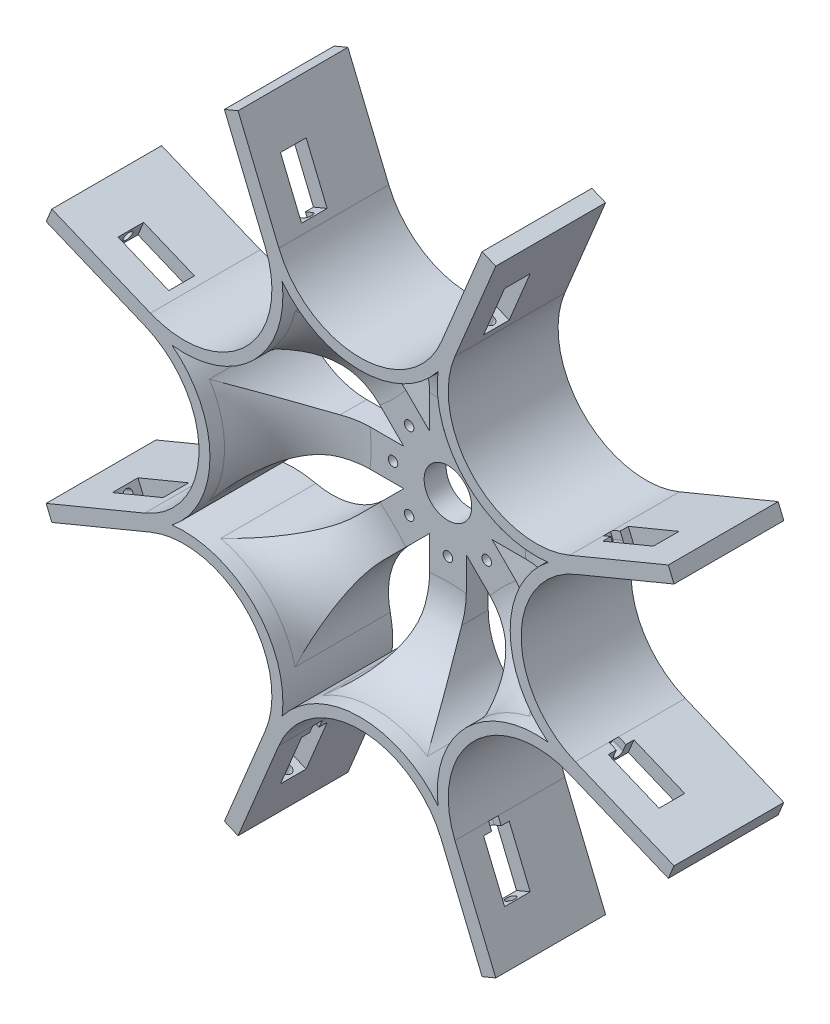
from build123d import *

# Parameters (mm, degrees)
MAIN_EXTRUSION_DEPTH         = 30
MAINREPETITION_DEPTH         = 30
ESQUISSE3_R                  = 1.3
CENTRAL_FIXING_DEPTH         = 6
FIXINGHOLEREPETITION_COUNT   = 8
CONG_4_R                     = 20
ESQUISSE4_R                  = 6.5
MAINHOLE_DEPTH               = 124.621368558
ESQUISSE5_W                  = 7
ESQUISSE5_H                  = 15
HOLEFORBEARING_DEPTH         = 5
ESQUISSE7_R                  = 1.3
ENL_V_MAT_EXTRU_3_DEPTH      = 3
ENL_V_MAT_EXTRU_2_DEPTH      = 3
R_P_TITION_CIRCULAIRE1_COUNT = 8


# Read off the part's stored shape, not the designer's step: MainRepetition
with BuildPart() as part:
    # Esquisse1 → Main Extrusion (new body)
    with BuildSketch(Plane.XY):
        with BuildLine():
            Line((57.667547326, 24.944747378), (84.602293038, 36.101484351))
            Line((84.602293038, 36.101484351), (85.750343335, 33.329845753))
            Line((85.750343335, 33.329845753), (58.815597623, 22.17310878))
            ThreePointArc((58.815597623, 22.17310878), (44, 0), (58.815597623, -22.17310878))
            Line((58.815597623, -22.17310878), (85.750343335, -33.329845753))
            Line((85.750343335, -33.329845753), (84.602293038, -36.101484351))
            Line((84.602293038, -36.101484351), (57.667547326, -24.944747378))
            ThreePointArc((57.667547326, -24.944747378), (41, 0), (57.667547326, 24.944747378))
        make_face()
    extrude(amount=MAIN_EXTRUSION_DEPTH)

    # MainRepetition outline → MainRepetition (add)
    with BuildSketch(Plane.XY):
        with BuildLine():
            Line((-84.202409209, -37.066889313), (-57.267663497, -25.91015234))
            ThreePointArc((-57.267663497, -25.91015234), (-31.112698372, -31.112698372), (-25.91015234, -57.267663497))
            Line((-25.91015234, -57.267663497), (-37.066889313, -84.202409209))
            Line((-37.066889313, -84.202409209), (-33.329845753, -85.750343335))
            Line((-33.329845753, -85.750343335), (-22.17310878, -58.815597623))
            ThreePointArc((-22.17310878, -58.815597623), (0, -44), (22.17310878, -58.815597623))
            Line((22.17310878, -58.815597623), (33.329845753, -85.750343335))
            Line((33.329845753, -85.750343335), (37.066889313, -84.202409209))
            Line((37.066889313, -84.202409209), (25.91015234, -57.267663497))
            ThreePointArc((25.91015234, -57.267663497), (31.112698372, -31.112698372), (57.267663497, -25.91015234))
            Line((57.267663497, -25.91015234), (84.202409209, -37.066889313))
            Line((84.202409209, -37.066889313), (84.602293038, -36.101484351))
            Line((84.602293038, -36.101484351), (57.667547326, -24.944747378))
            ThreePointArc((57.667547326, -24.944747378), (54.405305377, -23.327757675), (51.390283197, -21.286552275))
            ThreePointArc((51.390283197, -21.286552275), (28.991378029, -28.991378029), (21.286552275, -51.390283197))
            ThreePointArc((21.286552275, -51.390283197), (0, -41), (-21.286552275, -51.390283197))
            ThreePointArc((-21.286552275, -51.390283197), (-28.991378029, -28.991378029), (-51.390283197, -21.286552275))
            ThreePointArc((-51.390283197, -21.286552275), (-41, 0), (-51.390283197, 21.286552275))
            ThreePointArc((-51.390283197, 21.286552275), (-28.991378029, 28.991378029), (-21.286552275, 51.390283197))
            ThreePointArc((-21.286552275, 51.390283197), (0, 41), (21.286552275, 51.390283197))
            ThreePointArc((21.286552275, 51.390283197), (28.991378029, 28.991378029), (51.390283197, 21.286552275))
            ThreePointArc((51.390283197, 21.286552275), (54.405305377, 23.327757675), (57.667547326, 24.944747378))
            Line((57.667547326, 24.944747378), (84.602293038, 36.101484351))
            Line((84.602293038, 36.101484351), (84.202409209, 37.066889313))
            Line((84.202409209, 37.066889313), (57.267663497, 25.91015234))
            ThreePointArc((57.267663497, 25.91015234), (31.112698372, 31.112698372), (25.91015234, 57.267663497))
            Line((25.91015234, 57.267663497), (37.066889313, 84.202409209))
            Line((37.066889313, 84.202409209), (33.329845753, 85.750343335))
            Line((33.329845753, 85.750343335), (22.17310878, 58.815597623))
            ThreePointArc((22.17310878, 58.815597623), (0, 44), (-22.17310878, 58.815597623))
            Line((-22.17310878, 58.815597623), (-33.329845753, 85.750343335))
            Line((-33.329845753, 85.750343335), (-37.066889313, 84.202409209))
            Line((-37.066889313, 84.202409209), (-25.91015234, 57.267663497))
            ThreePointArc((-25.91015234, 57.267663497), (-31.112698372, 31.112698372), (-57.267663497, 25.91015234))
            Line((-57.267663497, 25.91015234), (-84.202409209, 37.066889313))
            Line((-84.202409209, 37.066889313), (-85.750343335, 33.329845753))
            Line((-85.750343335, 33.329845753), (-58.815597623, 22.17310878))
            ThreePointArc((-58.815597623, 22.17310878), (-44, 0), (-58.815597623, -22.17310878))
            Line((-58.815597623, -22.17310878), (-85.750343335, -33.329845753))
            Line((-85.750343335, -33.329845753), (-84.202409209, -37.066889313))
        make_face()
    extrude(amount=MAINREPETITION_DEPTH)

    # Esquisse3 → Central Fixing (add)
    with BuildSketch(Plane(origin=(0, 0, 0), x_dir=(-1, 0, 0), z_dir=(0, 0, -1))):
        with BuildLine():
            Line((-5, 44.526610811), (-5, 0))
            Line((-5, 0), (-4, 0))
            Line((-4, 0), (-4, 5))
            Line((-4, 5), (4, 5))
            Line((4, 5), (4, 0))
            Line((4, 0), (5, 0))
            Line((5, 0), (5, 44.526610811))
            ThreePointArc((5, 44.526610811), (0, 44), (-5, 44.526610811))
        make_face()
        with Locations((0, 15)):
            Circle(ESQUISSE3_R, mode=Mode.SUBTRACT)
    central_fixing = extrude(amount=-CENTRAL_FIXING_DEPTH)

    # FixingHoleRepetition: Central Fixing ×8 about axis
    fixingholerepetition_axis = Axis((0, 0, 0), (0, 0, 1))
    for i in range(1, FIXINGHOLEREPETITION_COUNT):
        add(central_fixing.rotate(fixingholerepetition_axis, i * 360 / FIXINGHOLEREPETITION_COUNT))

    # Congé4
    cong_4_edges = [part.edges().sort_by_distance(p)[0] for p in [
        (-5, 41.467001677, 3),
        (5, 41.467001677, 3),
        (0, 41, 6),
        (41, 0, 6),
        (28.991378029, 28.991378029, 6),
        (-28.991378029, 28.991378029, 6),
        (-41, 0, 6),
        (-28.991378029, -28.991378029, 6),
        (0, -41, 6),
        (28.991378029, -28.991378029, 6),
        (-32.857131988, 25.786064176, 3),
        (-25.786064176, 32.857131988, 3),
        (-41.467001677, -5, 3),
        (-41.467001677, 5, 3),
        (-5, -41.467001677, 3),
        (32.857131988, 25.786064176, 3),
        (41.467001677, 5, 3),
        (41.467001677, -5, 3),
        (32.857131988, -25.786064176, 3),
        (25.786064176, -32.857131988, 3),
        (5, -41.467001677, 3),
        (25.786064176, 32.857131988, 3),
        (-25.786064176, -32.857131988, 3),
        (-32.857131988, -25.786064176, 3),
    ]]
    fillet(cong_4_edges, radius=CONG_4_R)

    # Esquisse4 → MainHole (cut, through all)
    with BuildSketch(Plane.XY.offset(6)):
        Circle(ESQUISSE4_R)
    extrude(amount=-MAINHOLE_DEPTH, mode=Mode.SUBTRACT)

    # Esquisse5 → HoleForBearing (cut, symmetric)
    with BuildSketch(Plane(origin=(0, 0, 0), x_dir=(0, 0, -1), z_dir=(0.9238795325112865, -0.3826834323650906, 0))):
        with Locations((-19.5, 72.477766886)):
            Rectangle(ESQUISSE5_W, ESQUISSE5_H)
    holeforbearing = extrude(amount=HOLEFORBEARING_DEPTH, both=True, mode=Mode.SUBTRACT)

    # Esquisse7 → Enlèv. mat.-Extru.3 (cut)
    with BuildSketch(Plane(origin=(30.606166345, 73.889821882, -59.823808211), x_dir=(0.8535533905932732, -0.3535533905932745, 0.3826834323650904), z_dir=(-0.38268343236509067, -0.9238795325112864, 0))):
        with Locations(Location((30.335116868, 73.294176386, 0), (0, 0, 337.5))):
            Circle(ESQUISSE7_R)
    enl_v_mat_extru_3 = extrude(amount=-ENL_V_MAT_EXTRU_3_DEPTH, mode=Mode.SUBTRACT)

    # Esquisse6 → Enlèv. mat.-Extru.2 (cut)
    with BuildSketch(Plane(origin=(24.865914859, 60.031628894, -37.823808211), x_dir=(-0.853553390593273, 0.35355339059327445, -0.3826834323650908), z_dir=(0.38268343236509067, 0.9238795325112864, 0))):
        with BuildLine():
            Line((-20.565838364, 54.935303587), (-22.413597429, 54.169936722))
            ThreePointArc((-22.413597429, 54.169936722), (-23.11715236, 52.471404868), (-21.418620505, 51.767849937))
            Line((-21.418620505, 51.767849937), (-19.57086144, 52.533216802))
            Line((-19.57086144, 52.533216802), (-20.565838364, 54.935303587))
        make_face()
    enl_v_mat_extru_2 = extrude(amount=-ENL_V_MAT_EXTRU_2_DEPTH, mode=Mode.SUBTRACT)

    # Répétition circulaire1: HoleForBearing, Enlèv. mat.-Extru.3, Enlèv. mat.-Extru.2 ×8 about axis
    r_p_tition_circulaire1_axis = Axis((0, 0, 0), (0, 0, 1))
    add([holeforbearing.rotate(r_p_tition_circulaire1_axis, i * 360 / R_P_TITION_CIRCULAIRE1_COUNT) for i in range(1, R_P_TITION_CIRCULAIRE1_COUNT)], mode=Mode.SUBTRACT)
    add([enl_v_mat_extru_3.rotate(r_p_tition_circulaire1_axis, i * 360 / R_P_TITION_CIRCULAIRE1_COUNT) for i in range(1, R_P_TITION_CIRCULAIRE1_COUNT)], mode=Mode.SUBTRACT)
    add([enl_v_mat_extru_2.rotate(r_p_tition_circulaire1_axis, i * 360 / R_P_TITION_CIRCULAIRE1_COUNT) for i in range(1, R_P_TITION_CIRCULAIRE1_COUNT)], mode=Mode.SUBTRACT)


solid = part.part
